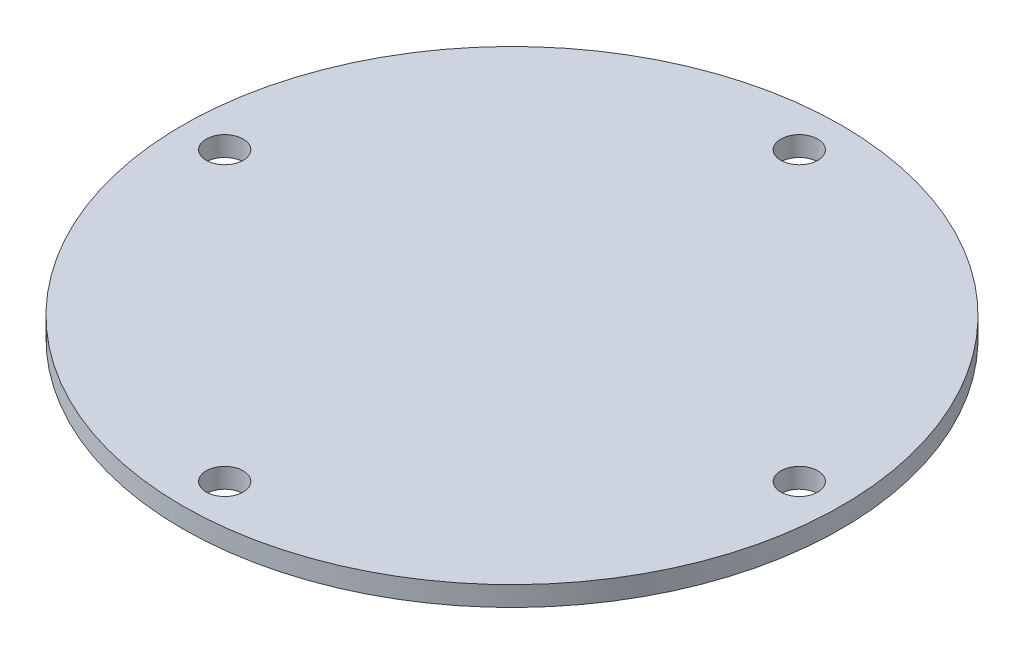
from build123d import *

# Parameters (mm, degrees)
SKETCH1_R            = 62.4
BOSS_EXTRUDE1_DEPTH  = 3.75
M6_CLEARANCE_HOLE1_D = 7
CIRPATTERN1_COUNT    = 4


with BuildPart() as part:
    # Sketch1 → Boss-Extrude1 (new body)
    with BuildSketch(Plane(origin=(0, 0, 0), x_dir=(1, 0, 0), z_dir=(0, 1, 0))):
        Circle(SKETCH1_R)
    extrude(amount=BOSS_EXTRUDE1_DEPTH)

    # M6 Clearance Hole1 (through all)
    with Locations(Plane(origin=(0, 3.75, 0), x_dir=(1, 0, 0), z_dir=(0, 1, 0))):
        with Locations((-54.4, 0)):
            m6_clearance_hole1 = Hole(M6_CLEARANCE_HOLE1_D / 2)

    # CirPattern1: M6 Clearance Hole1 ×4 about axis
    cirpattern1_axis = Axis((0, 3.75, 0), (0, -1, 0))
    for i in range(1, CIRPATTERN1_COUNT):
        add(m6_clearance_hole1.rotate(cirpattern1_axis, i * 360 / CIRPATTERN1_COUNT), mode=Mode.SUBTRACT)


solid = part.part
